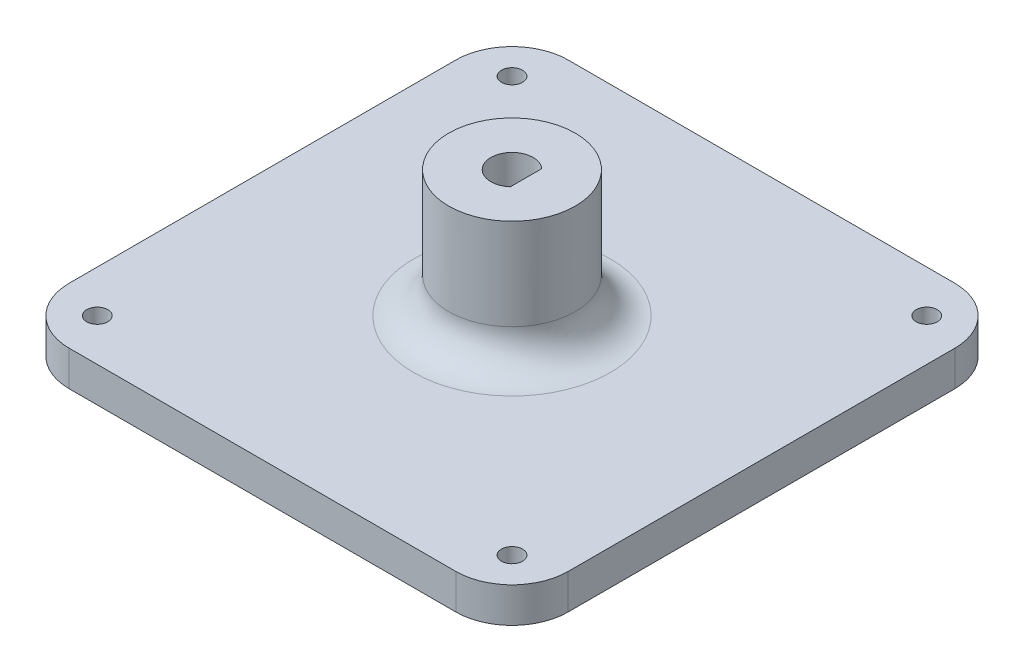
from build123d import *

# Parameters (mm, degrees)
SKETCH1_W           = 71
SKETCH1_H           = 71
BOSS_EXTRUDE1_DEPTH = 5
SKETCH2_R           = 9
BOSS_EXTRUDE2_DEPTH = 18
FILLET1_R           = 5
CUT_EXTRUDE1_DEPTH  = 16
FILLET2_R           = 8
SKETCH4_R           = 1.5
CUT_EXTRUDE2_DEPTH  = 103.00980345
CUT_EXTRUDE3_DEPTH  = 10


with BuildPart() as part:
    # Sketch1 → Boss-Extrude1 (new body)
    with BuildSketch(Plane(origin=(0, 0, 0), x_dir=(1, 0, 0), z_dir=(0, 1, 0))):
        with Locations((35.5, 35.5)):
            Rectangle(SKETCH1_W, SKETCH1_H)
    extrude(amount=BOSS_EXTRUDE1_DEPTH)

    # Sketch2 → Boss-Extrude2 (add)
    with BuildSketch(Plane(origin=(0, 5, 0), x_dir=(1, 0, 0), z_dir=(0, 1, 0))):
        with Locations((35.5, 35.5)):
            Circle(SKETCH2_R)
    extrude(amount=BOSS_EXTRUDE2_DEPTH)

    # Fillet1
    fillet1_edges = [part.edges().sort_by_distance(p)[0] for p in [
        (26.5, 5, -35.5),
    ]]
    fillet(fillet1_edges, radius=FILLET1_R)

    # Sketch3 → Cut-Extrude1 (cut)
    with BuildSketch(Plane(origin=(0, 23, 0), x_dir=(1, 0, 0), z_dir=(0, 1, 0))):
        with BuildLine():
            Line((37.5, 33.263932023), (37.5, 37.736067977))
            ThreePointArc((37.5, 37.736067977), (32.5, 35.5), (37.5, 33.263932023))
        make_face()
    extrude(amount=-CUT_EXTRUDE1_DEPTH, mode=Mode.SUBTRACT)

    # Fillet2
    fillet2_edges = [part.edges().sort_by_distance(p)[0] for p in [
        (0, 2.5, 0),
        (71, 2.5, 0),
        (71, 2.5, -71),
        (0, 2.5, -71),
    ]]
    fillet(fillet2_edges, radius=FILLET2_R)

    # Sketch4 → Cut-Extrude2 (cut, through all)
    with BuildSketch(Plane(origin=(0, 5, 0), x_dir=(1, 0, 0), z_dir=(0, 1, 0))):
        with Locations((65, 65)):
            Circle(SKETCH4_R)
        with Locations((65, 6)):
            Circle(SKETCH4_R)
        with Locations((6, 6)):
            Circle(SKETCH4_R)
        with Locations((6, 65)):
            Circle(SKETCH4_R)
    extrude(amount=-CUT_EXTRUDE2_DEPTH, mode=Mode.SUBTRACT)

    # Sketch5 → Cut-Extrude3 (cut)
    with BuildSketch(Plane(origin=(0, 0, 0), x_dir=(-1, 0, 0), z_dir=(0, -1, 0))):
        Polygon((-43.698373822, 35.5), (-39.599186911, 28.4), (-31.400813089, 28.4), (-27.301626178, 35.5), (-31.400813089, 42.6), (-39.599186911, 42.6), align=None)
    extrude(amount=-CUT_EXTRUDE3_DEPTH, mode=Mode.SUBTRACT)


solid = part.part
